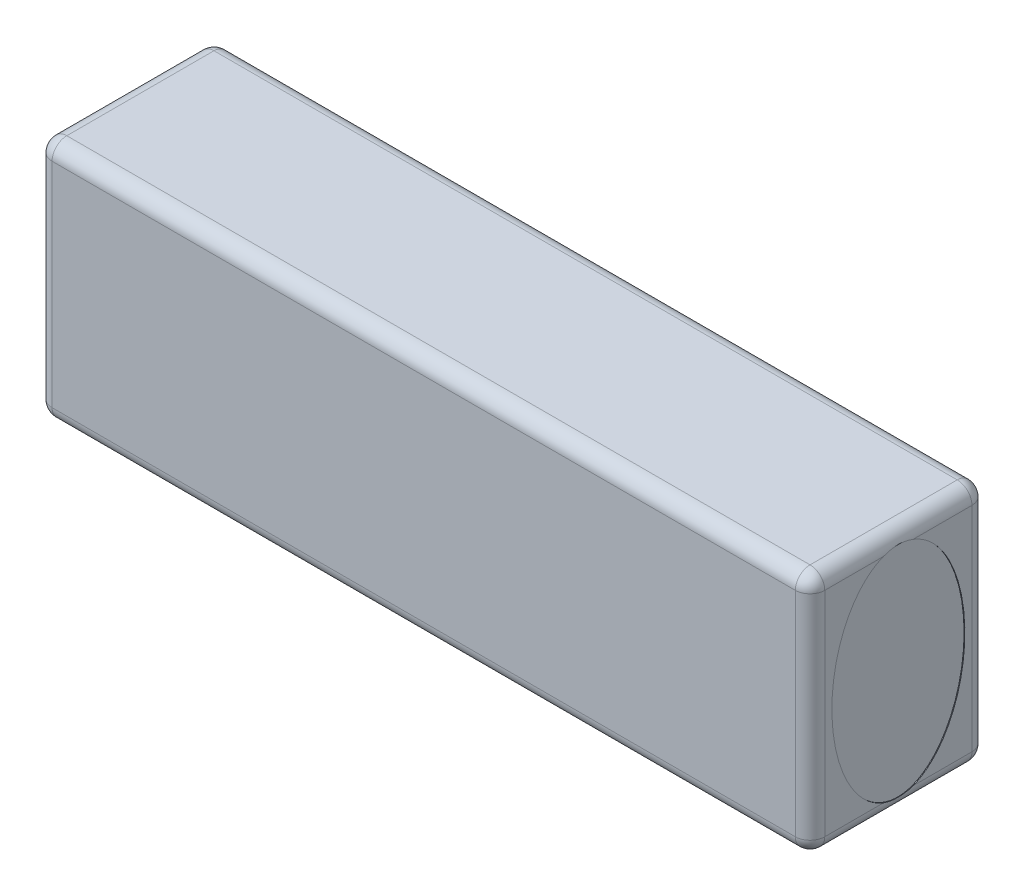
from build123d import *

# Parameters (mm, degrees)
ESQUISSE1_W             = 105
ESQUISSE1_H             = 33
BOSS_EXTRU_1_DEPTH      = 24
ESQUISSE2_RX            = 14.870046763
ESQUISSE2_RY            = 9.032322921
ENL_V_MAT_EXTRU_1_DEPTH = 0.1
CONG_1_R                = 2


with BuildPart() as part:
    # Esquisse1 → Boss.-Extru.1 (new body)
    with BuildSketch(Plane.XY):
        with Locations((52.5, 16.5)):
            Rectangle(ESQUISSE1_W, ESQUISSE1_H)
    extrude(amount=BOSS_EXTRU_1_DEPTH)

    # Esquisse2 → Enlèv. mat.-Extru.1 (cut)
    with BuildSketch(Plane.ZY):
        with Locations(Location((12, 16.5), (0, 0, 90))):
            Ellipse(ESQUISSE2_RX, ESQUISSE2_RY)
    enl_v_mat_extru_1 = extrude(amount=-ENL_V_MAT_EXTRU_1_DEPTH, mode=Mode.SUBTRACT)

    # Symétrie1: Enlèv. mat.-Extru.1 across plane
    add(enl_v_mat_extru_1.mirror(Plane.ZY.offset(-52.5)), mode=Mode.SUBTRACT)

    # Congé1
    # the kernel refuses this fillet: 2 mm, written as the material it takes off along each edge
    with BuildSketch(Plane(origin=(103, 2, 22), x_dir=(1, 0, 0), z_dir=(0, -1, 0))) as cong_1_piece_1_section:
        Polygon((0, 0), (CONG_1_R, 0), (CONG_1_R, CONG_1_R), (0, CONG_1_R), align=None)
    cong_1_piece_1 = extrude(amount=CONG_1_R, mode=Mode.PRIVATE)
    cong_1_piece_1 = cong_1_piece_1 - Plane(origin=(103, 2, 22), x_dir=(-0.7071067811865475, 0, -0.7071067811865475), z_dir=(0, -1, 0)) * Sphere(CONG_1_R, mode=Mode.PRIVATE)
    add(cong_1_piece_1, mode=Mode.SUBTRACT)
    with BuildSketch(Plane(origin=(103, 31, 22), x_dir=(0, 0, 1), z_dir=(1, 0, 0))) as cong_1_piece_2_section:
        Polygon((0, 0), (CONG_1_R, 0), (CONG_1_R, -CONG_1_R), (0, -CONG_1_R), align=None)
    cong_1_piece_2 = extrude(amount=CONG_1_R, mode=Mode.PRIVATE)
    cong_1_piece_2 = cong_1_piece_2 - Plane(origin=(103, 31, 22), x_dir=(0, -0.7071067811865475, -0.7071067811865475), z_dir=(1, 0, 0)) * Sphere(CONG_1_R, mode=Mode.PRIVATE)
    add(cong_1_piece_2, mode=Mode.SUBTRACT)
    with BuildSketch(Plane(origin=(2, 31, 22), x_dir=(0, 0, 1), z_dir=(-1, 0, 0))) as cong_1_piece_3_section:
        Polygon((0, 0), (CONG_1_R, 0), (CONG_1_R, CONG_1_R), (0, CONG_1_R), align=None)
    cong_1_piece_3 = extrude(amount=CONG_1_R, mode=Mode.PRIVATE)
    cong_1_piece_3 = cong_1_piece_3 - Plane(origin=(2, 31, 22), x_dir=(0, -0.7071067811865475, -0.7071067811865475), z_dir=(-1, 0, 0)) * Sphere(CONG_1_R, mode=Mode.PRIVATE)
    add(cong_1_piece_3, mode=Mode.SUBTRACT)
    with BuildSketch(Plane(origin=(2, 2, 22), x_dir=(-1, 0, 0), z_dir=(0, -1, 0))) as cong_1_piece_4_section:
        Polygon((0, 0), (CONG_1_R, 0), (CONG_1_R, -CONG_1_R), (0, -CONG_1_R), align=None)
    cong_1_piece_4 = extrude(amount=CONG_1_R, mode=Mode.PRIVATE)
    cong_1_piece_4 = cong_1_piece_4 - Plane(origin=(2, 2, 22), x_dir=(0.7071067811865475, 0, -0.7071067811865475), z_dir=(0, -1, 0)) * Sphere(CONG_1_R, mode=Mode.PRIVATE)
    add(cong_1_piece_4, mode=Mode.SUBTRACT)
    with BuildSketch(Plane(origin=(103, 31, 2), x_dir=(0, 0, -1), z_dir=(1, 0, 0))) as cong_1_piece_5_section:
        Polygon((0, 0), (CONG_1_R, 0), (CONG_1_R, CONG_1_R), (0, CONG_1_R), align=None)
    cong_1_piece_5 = extrude(amount=CONG_1_R, mode=Mode.PRIVATE)
    cong_1_piece_5 = cong_1_piece_5 - Plane(origin=(103, 31, 2), x_dir=(0, -0.7071067811865475, 0.7071067811865475), z_dir=(1, 0, 0)) * Sphere(CONG_1_R, mode=Mode.PRIVATE)
    add(cong_1_piece_5, mode=Mode.SUBTRACT)
    with BuildSketch(Plane(origin=(2, 31, 2), x_dir=(0, 0, -1), z_dir=(-1, 0, 0))) as cong_1_piece_6_section:
        Polygon((0, 0), (CONG_1_R, 0), (CONG_1_R, -CONG_1_R), (0, -CONG_1_R), align=None)
    cong_1_piece_6 = extrude(amount=CONG_1_R, mode=Mode.PRIVATE)
    cong_1_piece_6 = cong_1_piece_6 - Plane(origin=(2, 31, 2), x_dir=(0, -0.7071067811865475, 0.7071067811865475), z_dir=(-1, 0, 0)) * Sphere(CONG_1_R, mode=Mode.PRIVATE)
    add(cong_1_piece_6, mode=Mode.SUBTRACT)
    with BuildSketch(Plane(origin=(103, 2, 2), x_dir=(1, 0, 0), z_dir=(0, -1, 0))) as cong_1_piece_7_section:
        Polygon((0, 0), (CONG_1_R, 0), (CONG_1_R, -CONG_1_R), (0, -CONG_1_R), align=None)
    cong_1_piece_7 = extrude(amount=CONG_1_R, mode=Mode.PRIVATE)
    cong_1_piece_7 = cong_1_piece_7 - Plane(origin=(103, 2, 2), x_dir=(-0.7071067811865475, 0, 0.7071067811865475), z_dir=(0, -1, 0)) * Sphere(CONG_1_R, mode=Mode.PRIVATE)
    add(cong_1_piece_7, mode=Mode.SUBTRACT)
    with BuildSketch(Plane(origin=(2, 2, 2), x_dir=(-1, 0, 0), z_dir=(0, -1, 0))) as cong_1_piece_8_section:
        Polygon((0, 0), (CONG_1_R, 0), (CONG_1_R, CONG_1_R), (0, CONG_1_R), align=None)
    cong_1_piece_8 = extrude(amount=CONG_1_R, mode=Mode.PRIVATE)
    cong_1_piece_8 = cong_1_piece_8 - Plane(origin=(2, 2, 2), x_dir=(0.7071067811865475, 0, 0.7071067811865475), z_dir=(0, -1, 0)) * Sphere(CONG_1_R, mode=Mode.PRIVATE)
    add(cong_1_piece_8, mode=Mode.SUBTRACT)
    with BuildSketch(Plane(origin=(105, 2, 24), x_dir=(0, 0, -1), z_dir=(0, 1, 0)), Plane(origin=(0, 31, 24), x_dir=(0, 0, -1), z_dir=(0, -1, 0))) as cong_1_piece_9:
        with BuildLine():
            CenterArc((CONG_1_R, CONG_1_R), CONG_1_R, 180, 90)
            Line((0, CONG_1_R), (0, 0))
            Line((0, 0), (CONG_1_R, 0))
        make_face()
    extrude(amount=29, mode=Mode.SUBTRACT)
    with BuildSketch(Plane(origin=(103, 33, 24), x_dir=(0, -1, 0), z_dir=(-1, 0, 0)), Plane(origin=(2, 0, 0), x_dir=(0, 0, 1), z_dir=(1, 0, 0))) as cong_1_piece_10:
        with BuildLine():
            CenterArc((CONG_1_R, -CONG_1_R), CONG_1_R, 90, 90)
            Line((0, -CONG_1_R), (0, 0))
            Line((0, 0), (CONG_1_R, 0))
        make_face()
    extrude(amount=101, mode=Mode.SUBTRACT)
    with BuildSketch(Plane(origin=(103, 33, 0), x_dir=(0, -1, 0), z_dir=(-1, 0, 0)), Plane(origin=(2, 0, 24), x_dir=(0, 0, -1), z_dir=(1, 0, 0))) as cong_1_piece_11:
        with BuildLine():
            CenterArc((CONG_1_R, CONG_1_R), CONG_1_R, 180, 90)
            Line((0, CONG_1_R), (0, 0))
            Line((0, 0), (CONG_1_R, 0))
        make_face()
    extrude(amount=101, mode=Mode.SUBTRACT)
    with BuildSketch(Plane(origin=(105, 2, 0), x_dir=(0, 0, 1), z_dir=(0, 1, 0)), Plane(origin=(0, 31, 0), x_dir=(0, 0, 1), z_dir=(0, -1, 0))) as cong_1_piece_12:
        with BuildLine():
            CenterArc((CONG_1_R, -CONG_1_R), CONG_1_R, 90, 90)
            Line((0, -CONG_1_R), (0, 0))
            Line((0, 0), (CONG_1_R, 0))
        make_face()
    extrude(amount=29, mode=Mode.SUBTRACT)
    with BuildSketch(Plane(origin=(0, 33, 2), x_dir=(0, -1, 0), z_dir=(0, 0, 1)), Plane(origin=(0, 0, 2), x_dir=(1, 0, 0), z_dir=(0, 0, 1))) as cong_1_piece_13:
        with BuildLine():
            CenterArc((CONG_1_R, CONG_1_R), CONG_1_R, 180, 90)
            Line((0, CONG_1_R), (0, 0))
            Line((0, 0), (CONG_1_R, 0))
        make_face()
    extrude(amount=20, mode=Mode.SUBTRACT)
    with BuildSketch(Plane(origin=(105, 33, 2), x_dir=(0, -1, 0), z_dir=(0, 0, 1)), Plane(origin=(105, 0, 2), x_dir=(-1, 0, 0), z_dir=(0, 0, 1))) as cong_1_piece_14:
        with BuildLine():
            CenterArc((CONG_1_R, -CONG_1_R), CONG_1_R, 90, 90)
            Line((0, -CONG_1_R), (0, 0))
            Line((0, 0), (CONG_1_R, 0))
        make_face()
    extrude(amount=20, mode=Mode.SUBTRACT)


solid = part.part
